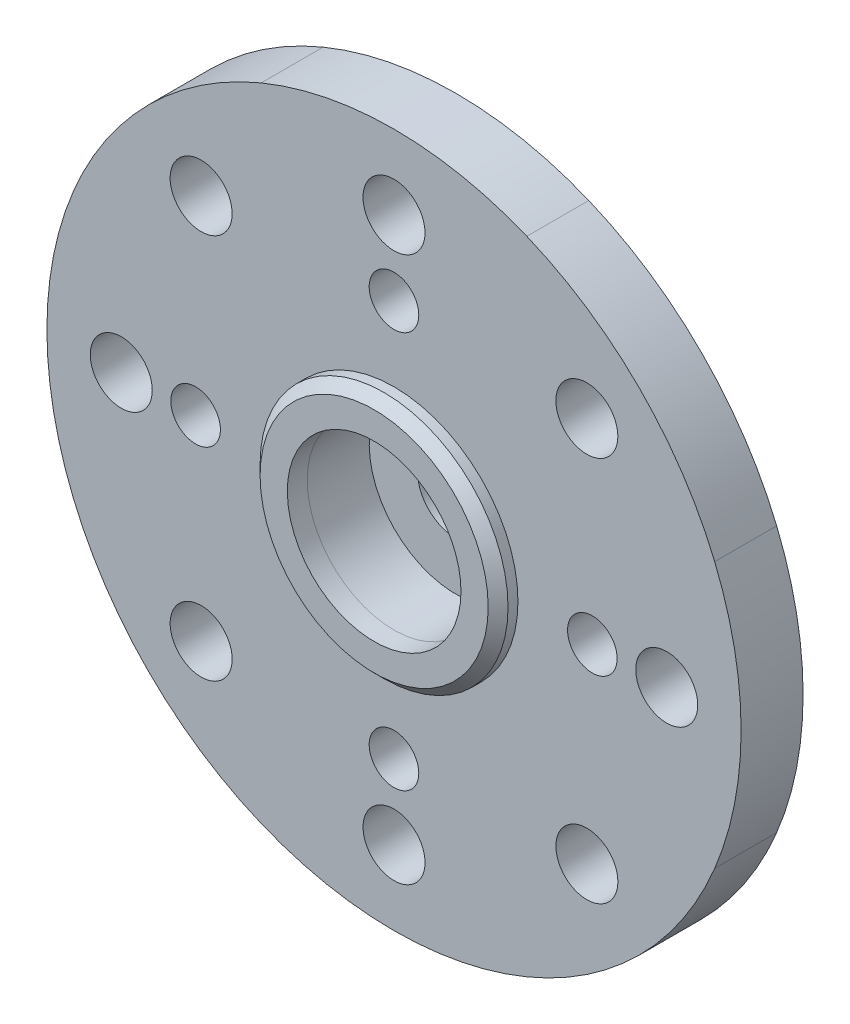
from build123d import *

# Parameters (mm, degrees)
BOSS_EXTRUDE1_OUTLINE_R   = 1.25
BOSS_EXTRUDE1_OUTLINE_R_2 = 1
BOSS_EXTRUDE1_OUTLINE_R_3 = 1.250000008
BOSS_EXTRUDE1_OUTLINE_R_4 = 3.5
BOSS_EXTRUDE1_DEPTH       = 2.5
SKETCH3_R                 = 5
SKETCH3_R_2               = 1.55
BOSS_EXTRUDE2_DEPTH       = 1.8
BOSS_EXTRUDE3_START       = 0.8
SKETCH4_R                 = 5
SKETCH4_R_2               = 3.501414214
BOSS_EXTRUDE3_DEPTH       = 0.8
CHAMFER1_SIZE             = 0.4


# Read off the part's stored shape, not the designer's step: Boss-Extrude1
with BuildPart() as part:
    # Boss-Extrude1 outline → Boss-Extrude1 (new body)
    with BuildSketch(Plane.XY):
        with BuildLine():
            ThreePointArc((5.357626608, 12.933703439), (0.000437376, 13.999000034), (-5.356666208, 12.933272824))
            ThreePointArc((-5.356666208, 12.933272824), (-9.898237759, 9.898337914), (-12.932759786, 5.356490479))
            ThreePointArc((-12.932759786, 5.356490479), (-13.997999982, -0.000709967), (-12.932216374, -5.357802331))
            ThreePointArc((-12.932216374, -5.357802331), (-9.897337875, -9.899237719), (-5.355626608, -12.933703348))
            ThreePointArc((-5.355626608, -12.933703348), (0.001636318, -13.99899994), (5.358802377, -12.933216328))
            ThreePointArc((5.358802377, -12.933216328), (9.900237764, -9.898337829), (12.934703393, -5.356626562))
            ThreePointArc((12.934703393, -5.356626562), (13.999999986, 0.000636364), (12.934216374, 5.357802422))
            ThreePointArc((12.934216374, 5.357802422), (9.899337875, 9.89923781), (5.357626608, 12.933703439))
        make_face()
        with Locations((-7.776467454, -7.778881622)):
            Circle(BOSS_EXTRUDE1_OUTLINE_R, mode=Mode.SUBTRACT)
        with Locations((0, -8)):
            Circle(BOSS_EXTRUDE1_OUTLINE_R_2, mode=Mode.SUBTRACT)
        with Locations((-10.998999955, -0.000999955)):
            Circle(BOSS_EXTRUDE1_OUTLINE_R, mode=Mode.SUBTRACT)
        with Locations((-8, 0)):
            Circle(BOSS_EXTRUDE1_OUTLINE_R_2, mode=Mode.SUBTRACT)
        with Locations((0.002, -10.999999909)):
            Circle(BOSS_EXTRUDE1_OUTLINE_R, mode=Mode.SUBTRACT)
        with Locations((7.779881668, -7.777467409)):
            Circle(BOSS_EXTRUDE1_OUTLINE_R_3, mode=Mode.SUBTRACT)
        with Locations((8, 0)):
            Circle(BOSS_EXTRUDE1_OUTLINE_R_2, mode=Mode.SUBTRACT)
        with Locations((0.000999955, 0.001000045)):
            Circle(BOSS_EXTRUDE1_OUTLINE_R_4, mode=Mode.SUBTRACT)
        with Locations((-7.777881668, 7.7774675)):
            Circle(BOSS_EXTRUDE1_OUTLINE_R, mode=Mode.SUBTRACT)
        with Locations((0, 8)):
            Circle(BOSS_EXTRUDE1_OUTLINE_R_2, mode=Mode.SUBTRACT)
        with Locations((0, 11)):
            Circle(BOSS_EXTRUDE1_OUTLINE_R, mode=Mode.SUBTRACT)
        with Locations((11.000999955, 0.001000045)):
            Circle(BOSS_EXTRUDE1_OUTLINE_R, mode=Mode.SUBTRACT)
        with Locations((7.778467454, 7.778881713)):
            Circle(BOSS_EXTRUDE1_OUTLINE_R, mode=Mode.SUBTRACT)
    extrude(amount=BOSS_EXTRUDE1_DEPTH)

    # Sketch3 → Boss-Extrude2 (add)
    with BuildSketch(Plane(origin=(0, 0, 0), x_dir=(-1, 0, 0), z_dir=(0, 0, -1))):
        with Locations(Location((0, 0, 0), (0, 0, 180))):
            Circle(SKETCH3_R)
        Circle(SKETCH3_R_2, mode=Mode.SUBTRACT)
    extrude(amount=BOSS_EXTRUDE2_DEPTH)

    # Sketch4 → Boss-Extrude3 (add)
    with BuildSketch(Plane.XY.offset(2.5).offset(BOSS_EXTRUDE3_START)):
        Circle(SKETCH4_R)
        with Locations(Location((0, 0, 0), (0, 0, 45.002604354))):
            Circle(SKETCH4_R_2, mode=Mode.SUBTRACT)
    extrude(amount=-BOSS_EXTRUDE3_DEPTH)

    # Chamfer1
    chamfer1_edges = [part.edges().sort_by_distance(p)[0] for p in [
        (-5, 0, 3.3),
    ]]
    chamfer(chamfer1_edges, length=CHAMFER1_SIZE)


solid = part.part
